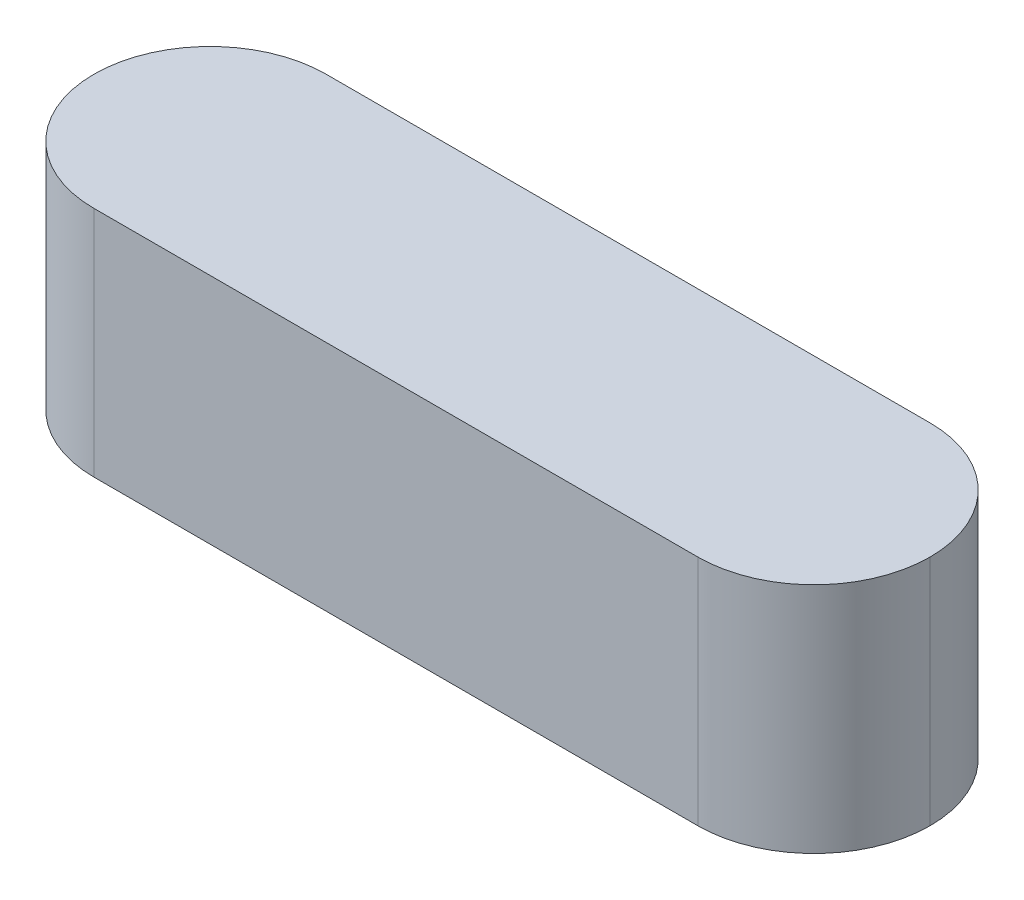
from build123d import *

# Parameters (mm, degrees)
SKETCH1_W           = 90
SKETCH1_H           = 25
BOSS_EXTRUDE1_DEPTH = 25.05
FILLET1_R           = 12.5
SKETCH2_R           = 1.5
CUT_EXTRUDE1_DEPTH  = 5


with BuildPart() as part:
    # Sketch1 → Boss-Extrude1 (new body)
    with BuildSketch(Plane(origin=(0, 0, 0), x_dir=(1, 0, 0), z_dir=(0, 1, 0))):
        with Locations((45, 12.5)):
            Rectangle(SKETCH1_W, SKETCH1_H)
    extrude(amount=BOSS_EXTRUDE1_DEPTH)

    # Fillet1
    fillet1_edges = [part.edges().sort_by_distance(p)[0] for p in [
        (90, 12.525, 0),
        (90, 12.525, -25),
        (0, 12.525, 0),
        (0, 12.525, -25),
    ]]
    fillet(fillet1_edges, radius=FILLET1_R - 0.0001)  # a hair under: the kernel refuses the full size

    # Sketch2 → Cut-Extrude1 (cut)
    with BuildSketch(Plane.XZ):
        with Locations(Location((22.5, -12.5, 0), (0, 0, 270))):
            Circle(SKETCH2_R)
        with Locations(Location((67.5, -12.5, 0), (0, 0, 270))):
            Circle(SKETCH2_R)
    extrude(amount=-CUT_EXTRUDE1_DEPTH, mode=Mode.SUBTRACT)


solid = part.part
